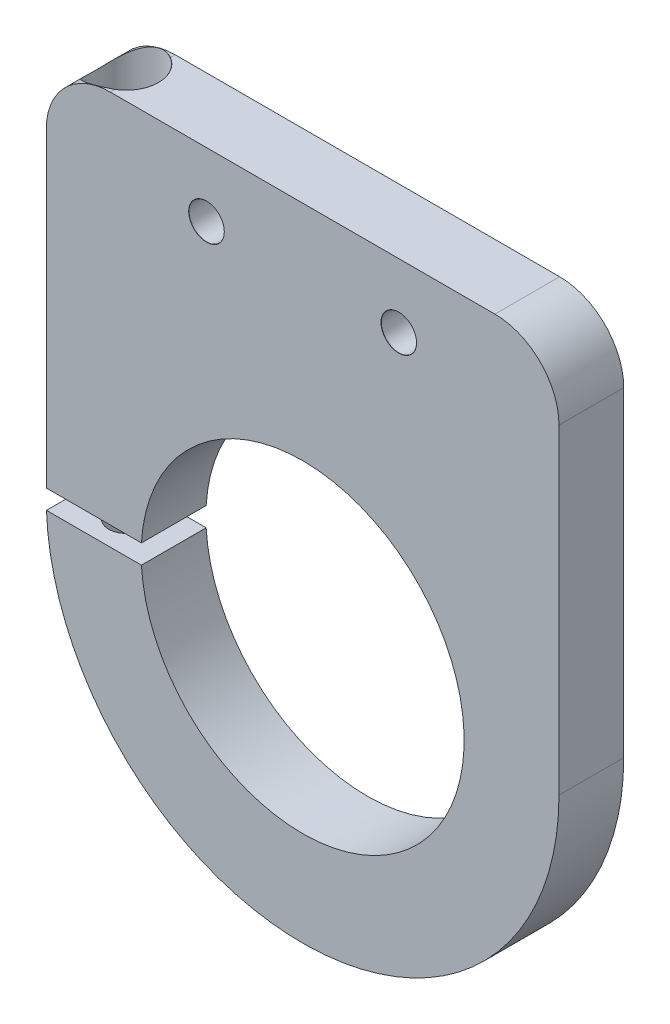
from build123d import *

# Parameters (mm, degrees)
BOSS_EXTRUDE1_DEPTH            = 10.1
SKETCH3_W                      = 14.844682471
SKETCH3_H                      = 3
CUT_EXTRUDE1_DEPTH             = 73.814902321
M5_CLEARANCE_HOLE1_D           = 5.5
M5_CLEARANCE_HOLE1_CSINK_D     = 5.55
M5_CLEARANCE_HOLE1_CSINK_ANGLE = 90
FILLET1_R                      = 10
CUT_EXTRUDE2_DEPTH             = 87.915246219


with BuildPart() as part:
    # Sketch2 → Boss-Extrude1 (new body)
    with BuildSketch(Plane.XY):
        with BuildLine():
            Line((-40, 60), (-40, 0))
            ThreePointArc((-40, 0), (0, 40), (40, 0))
            Line((40, 0), (40, 60))
            Line((40, 60), (-40, 60))
        make_face()
        with BuildLine():
            ThreePointArc((40, 0), (0, 40), (-40, 0))
            Line((-40, 0), (-25.2, 0))
            ThreePointArc((-25.2, 0), (0, 25.2), (25.2, 0))
            Line((25.2, 0), (40, 0))
        make_face()
        with BuildLine():
            Line((-25.2, 0), (-40, 0))
            ThreePointArc((-40, 0), (0, -40), (40, 0))
            Line((40, 0), (25.2, 0))
            ThreePointArc((25.2, 0), (0, -25.2), (-25.2, 0))
        make_face()
    extrude(amount=BOSS_EXTRUDE1_DEPTH)

    # Sketch3 → Cut-Extrude1 (cut, through all)
    with BuildSketch(Plane.XY.offset(10.1)):
        with Locations((-32.577658765, 0)):
            Rectangle(SKETCH3_W, SKETCH3_H)
    extrude(amount=-CUT_EXTRUDE1_DEPTH, mode=Mode.SUBTRACT)

    # Sketch10 → CBORE for M5 SHCS3 (revolve, cut)
    with BuildSketch(Plane(origin=(-32.563591317, 60, 5.05), x_dir=(0, 0, 1), z_dir=(1, 0, 0))):
        Polygon((0, 0), (0, 100), (2.75, 100), (2.75, 10), (5, 10), (5, 0.025), (5.025, 0), align=None)
    revolve(axis=Axis((-32.563591317, 66.35, 5.05), (0, -1, 0)), mode=Mode.SUBTRACT)

    # M5 Clearance Hole1 (through all)
    with Locations(Plane.XY.offset(10.1)):
        with Locations((-15, 50), (15, 50)):
            CounterSinkHole(M5_CLEARANCE_HOLE1_D / 2, M5_CLEARANCE_HOLE1_CSINK_D / 2, counter_sink_angle=M5_CLEARANCE_HOLE1_CSINK_ANGLE)

    # Fillet1
    # the kernel refuses this fillet: 10 mm, written as the material it takes off along each edge
    with BuildSketch(Plane(origin=(-40, 60, -25), x_dir=(0, -1, 0), z_dir=(0, 0, 1))) as fillet1_piece_1:
        with BuildLine():
            CenterArc((FILLET1_R, FILLET1_R), FILLET1_R, 180, 90)
            Line((0, FILLET1_R), (0, 0))
            Line((0, 0), (FILLET1_R, 0))
        make_face()
    extrude(amount=60.1, mode=Mode.SUBTRACT)
    with BuildSketch(Plane(origin=(40, 60, -25), x_dir=(0, -1, 0), z_dir=(0, 0, 1))) as fillet1_piece_2:
        with BuildLine():
            CenterArc((FILLET1_R, -FILLET1_R), FILLET1_R, 90, 90)
            Line((0, -FILLET1_R), (0, 0))
            Line((0, 0), (FILLET1_R, 0))
        make_face()
    extrude(amount=60.1, mode=Mode.SUBTRACT)

    # Sketch18 → Cut-Extrude2 (cut, through all)
    with BuildSketch(Plane(origin=(0, -16.5, 0), x_dir=(1, 0, 0), z_dir=(0, 1, 0))):
        Polygon((-27.82931911, -5.05), (-30.196455214, -0.95), (-34.930727421, -0.95), (-37.297863525, -5.05), (-34.930727421, -9.15), (-30.196455214, -9.15), align=None)
    extrude(amount=-CUT_EXTRUDE2_DEPTH, mode=Mode.SUBTRACT)


solid = part.part
